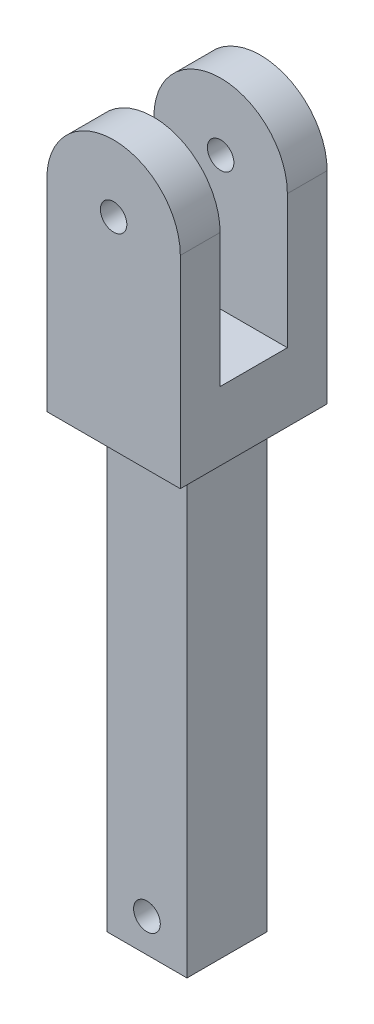
from build123d import *

# Parameters (mm, degrees)
EXTRUDE_1_DEPTH     = 12
CUT_EXTRUDE_1_DEPTH = 39.218600963
CUT_EXTRUDE_6_DEPTH = 39.218600963
SKETCH_12_R         = 1.985
EXTRUDE_11_DEPTH    = 5
EXTRUDE_START       = 5
SKETCH_13_R         = 1.985
EXTRUDE_12_DEPTH    = 5
SKETCH_14_W         = 10.08
SKETCH_14_H         = 30
CUT_EXTRUDE_7_DEPTH = 41.070705753
SKETCH_15_W         = 12
SKETCH_15_H         = 12
EXTRUDE_13_DEPTH    = 68
CUT_EXTRUDE_8_DEPTH = 101.235992767


with BuildPart() as part:
    # 草圖1 → 填料-伸長1 (new body)
    with BuildSketch(Plane.XY):
        with BuildLine():
            ThreePointArc((10, 0), (0, 10), (-10, 0))
            Line((-10, 0), (-10, -30.276417548))
            Line((-10, -30.276417548), (10, -30.276417548))
            Line((10, -30.276417548), (10, 0))
        make_face()
        with BuildLine():
            ThreePointArc((0, -1.985), (-1.403606961, 1.403606961), (1.985, 0))
            ThreePointArc((1.985, 0), (1.403606961, -1.403606961), (0, -1.985))
        make_face(mode=Mode.SUBTRACT)
    extrude(amount=EXTRUDE_1_DEPTH)

    # 草圖2 → 除料-伸長1 (cut, through all)
    with BuildSketch(Plane(origin=(10, 0, 0), x_dir=(0, 0, -1), z_dir=(1, 0, 0))):
        Polygon((-9, 15.780779257), (-9, 0), (-8.60053373, -20), (-3, -20), (-3, 15.780779257), align=None)
    extrude(amount=-CUT_EXTRUDE_1_DEPTH, mode=Mode.SUBTRACT)

    # 草圖11 → 除料-伸長6 (cut, through all)
    with BuildSketch(Plane(origin=(10, 0, 0), x_dir=(0, 0, -1), z_dir=(1, 0, 0))):
        Polygon((-9, 0), (-9, -20), (-8.60053373, -20), align=None)
    extrude(amount=-CUT_EXTRUDE_6_DEPTH, mode=Mode.SUBTRACT)

    # 草圖12 → 填料-伸長11 (add)
    with BuildSketch(Plane.XY.offset(12)):
        with BuildLine():
            Line((10, -30.276417548), (10, 0))
            ThreePointArc((10, 0), (0, 10), (-10, 0))
            Line((-10, 0), (-10, -30.276417548))
            Line((-10, -30.276417548), (10, -30.276417548))
        make_face()
        Circle(SKETCH_12_R, mode=Mode.SUBTRACT)
    extrude(amount=EXTRUDE_11_DEPTH)

    # 草圖13 → 填料-伸長12 (add)
    with BuildSketch(Plane(origin=(0, 0, 0), x_dir=(-1, 0, 0), z_dir=(0, 0, -1)).offset(EXTRUDE_START)):
        with BuildLine():
            Line((10, -30.276417548), (10, 0))
            ThreePointArc((10, 0), (0, 10), (-10, 0))
            Line((-10, 0), (-10, -30.276417548))
            Line((-10, -30.276417548), (10, -30.276417548))
        make_face()
        Circle(SKETCH_13_R, mode=Mode.SUBTRACT)
    extrude(amount=-EXTRUDE_12_DEPTH)

    # 草圖14 → 除料-伸長7 (cut, through all)
    with BuildSketch(Plane.ZY.offset(10)):
        with Locations((6, -5)):
            Rectangle(SKETCH_14_W, SKETCH_14_H)
    extrude(amount=-CUT_EXTRUDE_7_DEPTH, mode=Mode.SUBTRACT)

    # 草圖15 → 填料-伸長13 (add)
    with BuildSketch(Plane.XZ.offset(30.276417548)):
        with Locations((0, 6)):
            Rectangle(SKETCH_15_W, SKETCH_15_H)
    extrude(amount=EXTRUDE_13_DEPTH)

    # 草圖17 → 除料-伸長8 (cut, through all)
    with BuildSketch(Plane(origin=(0, 0, 0), x_dir=(-1, 0, 0), z_dir=(0, 0, -1))):
        with BuildLine():
            ThreePointArc((0, -95.276417548), (1.414213562, -94.69063111), (2, -93.276417548))
            ThreePointArc((2, -93.276417548), (-1.414213562, -91.862203986), (0, -95.276417548))
        make_face()
    extrude(amount=-CUT_EXTRUDE_8_DEPTH, mode=Mode.SUBTRACT)


solid = part.part
